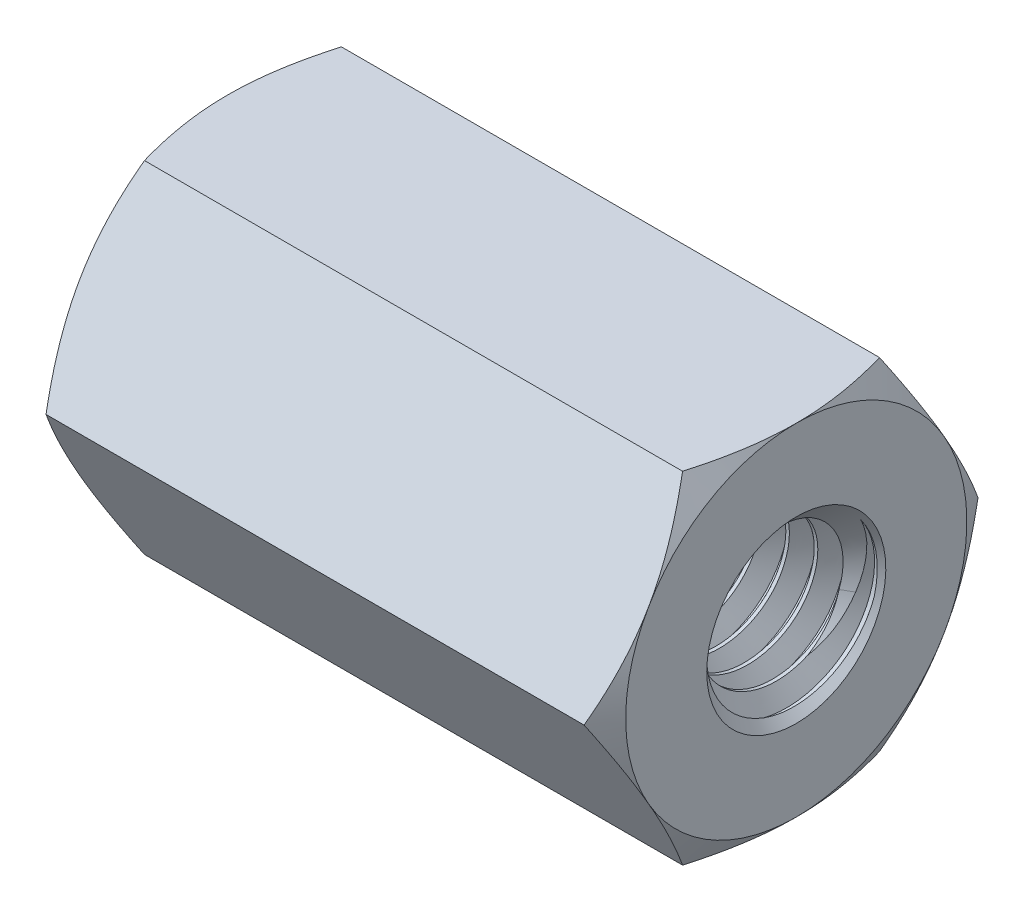
from build123d import *
from build123d.topology import SkipClean

# Parameters (mm, degrees)
BOSS_EXTRUDE1_DEPTH          = 10
SKETCH4_OUTSIDE_W            = 53.21
SKETCH4_OUTSIDE_H            = 52.282
SKETCH4_OUTSIDE_R            = 3
CUT_EXTRUDE1_DEPTH           = 12
CUT_EXTRUDE1_DRAFT           = -60
SKETCH5_OUTSIDE_W            = 53.21
SKETCH5_OUTSIDE_H            = 52.282
SKETCH5_OUTSIDE_R            = 3
CUT_EXTRUDE2_DEPTH           = 12
CUT_EXTRUDE2_DRAFT           = -60
SWEEP1_PITCH                 = 0.5
SWEEP1_HEIGHT                = 10.5
SWEEP1_RADIUS                = 1.5
SWEEP1_START_ANGLE           = -90
SKETCH8_R                    = 1.575
CUT_EXTRUDE3_OTHER_WAY_DEPTH = 12.472977544
CUT_EXTRUDE3_OTHER_WAY_TAPER = -45
SKETCH9_R                    = 1.575
CUT_EXTRUDE4_OTHER_WAY_DEPTH = 12.000000091
CUT_EXTRUDE4_OTHER_WAY_TAPER = -45


with BuildPart() as part:
    # Sketch2 → Boss-Extrude1 (new body)
    with BuildSketch(Plane(origin=(0, 0, 0), x_dir=(0, 0, -1), z_dir=(1, 0, 0))):
        Polygon((1.732050808, 3), (-1.732050808, 3), (-3.464101615, 0), (-1.732050808, -3), (1.732050808, -3), (3.464101615, 0), align=None)
    extrude(amount=BOSS_EXTRUDE1_DEPTH)

    # Sketch3 → Cut-Revolve1 (revolve, cut)
    with BuildSketch(Plane.XY, mode=Mode.PRIVATE) as cut_revolve1_sk:
        Polygon((0, 1.575), (0.075, 1.5), (9.925, 1.5), (10, 1.575), (10, 0), (0, 0), align=None)
    revolve(cut_revolve1_sk.sketch.rotate(Axis((0, 0, 0), (1, 0, 0)), 90), axis=Axis((0, 0, 0), (1, 0, 0)), mode=Mode.SUBTRACT)


with BuildPart() as cut_extrude1_tool:
    # Sketch4 outside → Cut-Extrude1 (with draft: the straight prism first)
    with BuildSketch(Plane.ZY):
        Rectangle(SKETCH4_OUTSIDE_W, SKETCH4_OUTSIDE_H)
        Circle(SKETCH4_OUTSIDE_R, mode=Mode.SUBTRACT)
    extrude(amount=-CUT_EXTRUDE1_DEPTH)
    # Cut-Extrude1: the draft: its side faces are tilted about the plane it starts from
    cut_extrude1_sides = [cut_extrude1_tool.faces().sort_by_distance(p)[0] for p in [
        (6, -26.141, 0),
        (6, 0, 26.605),
        (6, 26.141, 0),
        (6, 0, -26.605),
        (6, 0, -3),
    ]]
    draft(cut_extrude1_sides, Plane.ZY, CUT_EXTRUDE1_DRAFT)


with BuildPart() as part_1:
    add(part.part)

    # Cut-Extrude1: cut by cut_extrude1_tool
    add(cut_extrude1_tool.part, mode=Mode.SUBTRACT)


with BuildPart() as cut_extrude2_tool:
    # Sketch5 outside → Cut-Extrude2 (with draft: the straight prism first)
    with BuildSketch(Plane(origin=(10, 0, 0), x_dir=(0, 0, -1), z_dir=(1, 0, 0))):
        Rectangle(SKETCH5_OUTSIDE_W, SKETCH5_OUTSIDE_H)
        Circle(SKETCH5_OUTSIDE_R, mode=Mode.SUBTRACT)
    extrude(amount=-CUT_EXTRUDE2_DEPTH)
    # Cut-Extrude2: the draft: its side faces are tilted about the plane it starts from
    cut_extrude2_sides = [cut_extrude2_tool.faces().sort_by_distance(p)[0] for p in [
        (4, -26.141, 0),
        (4, 0, -26.605),
        (4, 26.141, 0),
        (4, 0, 26.605),
        (4, 0, 3),
    ]]
    draft(cut_extrude2_sides, Plane(origin=(10, 0, 0), x_dir=(0, 0, -1), z_dir=(1, 0, 0)), CUT_EXTRUDE2_DRAFT)


with BuildPart() as part_2:
    add(part_1.part)

    # Cut-Extrude2: cut by cut_extrude2_tool
    add(cut_extrude2_tool.part, mode=Mode.SUBTRACT)

    # Sweep1: sweep along a helix
    with BuildLine() as sweep1_path:
        add(Helix(SWEEP1_PITCH, SWEEP1_HEIGHT, SWEEP1_RADIUS, center=(0, 0, 0), direction=(1, 0, 0), mode=Mode.PRIVATE).rotate(Axis((0, 0, 0), (1, 0, 0)), SWEEP1_START_ANGLE))
    # Sketch6 → Sweep1 (sweep)
    with BuildSketch(Plane.XY):
        Polygon((-0.445873412, 1.53125), (0.018042196, 1.53125), (-0.182665608, 1.183613886), (-0.245165608, 1.183613886), align=None)
    sweep(path=sweep1_path.line, is_frenet=True)

    # Cut-Extrude3 cone 1 section (through the dimple's axis) → Cut-Extrude3 (revolve, cut)
    with BuildSketch(Plane.ZX):
        Polygon((0, 0), (1.575, 0), (0, 1.575), align=None)
    revolve(axis=Axis((0, 0, 0), (1, 0, 0)), mode=Mode.SUBTRACT)

    # Sketch8 → Cut-Extrude3 other way (cut)
    with BuildSketch(Plane.ZY):
        Circle(SKETCH8_R)
    extrude(amount=CUT_EXTRUDE3_OTHER_WAY_DEPTH, taper=CUT_EXTRUDE3_OTHER_WAY_TAPER, mode=Mode.SUBTRACT)

    # Cut-Extrude4 cone 1 section (through the dimple's axis) → Cut-Extrude4 (revolve, cut)
    with SkipClean():  # the faces are left unmerged after this step: merging them gives an invalid solid
        with BuildSketch(Plane(origin=(10, 0, 0), x_dir=(0, 0, -1), z_dir=(0, 1, 0))):
            Polygon((0, 0), (1.575, 0), (0, 1.575), align=None)
        revolve(axis=Axis((10, 0, 0), (-1, 0, 0)), mode=Mode.SUBTRACT)

    # Sketch9 → Cut-Extrude4 other way (cut)
    with SkipClean():  # the faces are left unmerged after this step: merging them gives an invalid solid
        with BuildSketch(Plane(origin=(10, 0, 0), x_dir=(0, 0, -1), z_dir=(1, 0, 0))):
            Circle(SKETCH9_R)
        extrude(amount=CUT_EXTRUDE4_OTHER_WAY_DEPTH, taper=CUT_EXTRUDE4_OTHER_WAY_TAPER, mode=Mode.SUBTRACT)


solid = part_2.part
